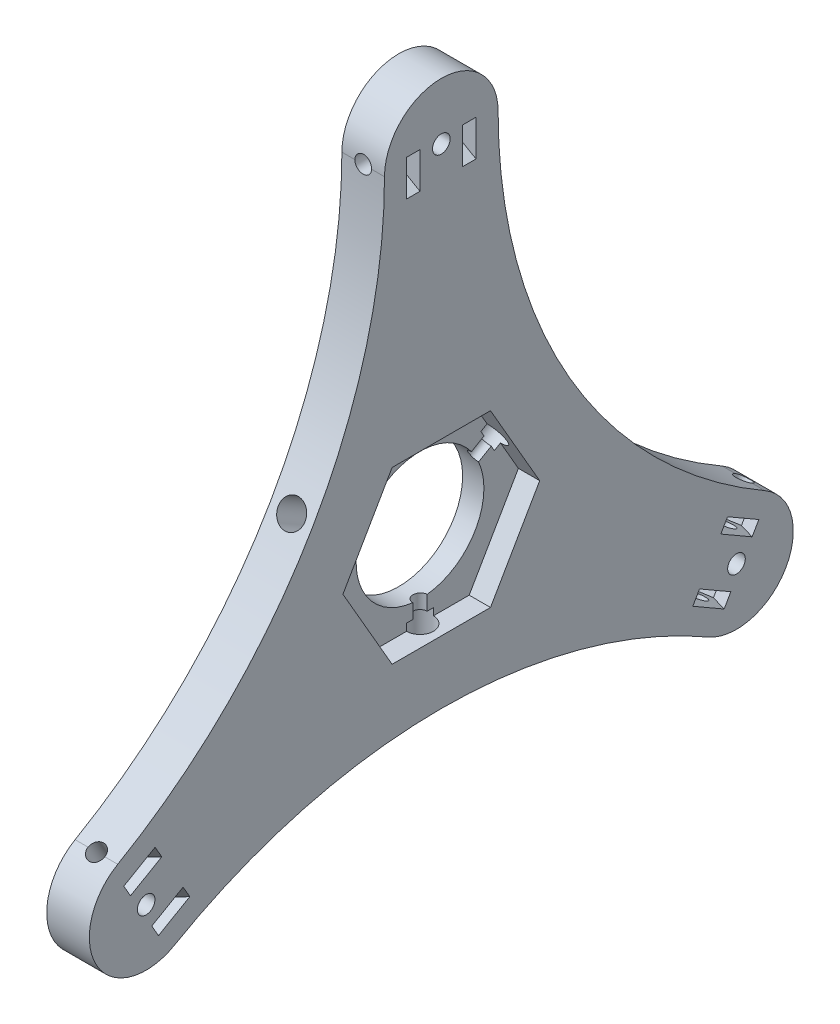
from build123d import *

# Parameters (mm, degrees)
SKETCH1_R                   = 1.9685
BOSS_EXTRUDE1_DEPTH         = 9.525
SKETCH3_R                   = 1.6
CUT_EXTRUDE1_DEPTH          = 121.530179668
CUT_EXTRUDE3_START          = -11.1125
SKETCH5_R                   = 2.999994
CUT_EXTRUDE3_DEPTH          = 110.417679676
CIRPATTERN9_COUNT           = 3
CUT_EXTRUDE2_START          = -3.175
CUT_EXTRUDE2_DEPTH          = 3.2
SKETCH6_R                   = 1.875
CUT_EXTRUDE4_DEPTH          = 120.105963224
CUT_EXTRUDE5_START          = -4.7625
CUT_EXTRUDE5_DEPTH          = 3
CIRPATTERN1_COUNT           = 3
CIRPATTERN1_COPY_1_SKETCH_R = 1.875
CIRPATTERN1_COPY_1_DEPTH    = 120.105963224
CIRPATTERN1_COPY_2_SKETCH_R = 1.875
CIRPATTERN1_COPY_2_DEPTH    = 120.105963224
CIRPATTERN1_START           = -4.7625
CIRPATTERN1_COPY_3_DEPTH    = 3
CIRPATTERN1_COPY_4_DEPTH    = 3
CIRPATTERN1_COPY_5_SKETCH_R = 1.875
CIRPATTERN1_COPY_5_DEPTH    = 120.105963224
CIRPATTERN1_COPY_6_SKETCH_R = 1.875
CIRPATTERN1_COPY_6_DEPTH    = 120.105963224
SKETCH8_R                   = 14.2875
CUT_EXTRUDE6_DEPTH          = 120.105963364
CUT_EXTRUDE7_DEPTH          = 4.7625


with BuildPart() as part:
    # Sketch1 → Boss-Extrude1 (new body)
    with BuildSketch(Plane(origin=(0, 0, 0), x_dir=(0, 0, -1), z_dir=(1, 0, 0))):
        with BuildLine():
            ThreePointArc((72.341135768, -27.101477372), (28.680794165, 16.558864232), (12.7, 76.2))
            ThreePointArc((12.7, 76.2), (0, 88.9), (-12.7, 76.2))
            ThreePointArc((-12.7, 76.2), (-28.680794165, 16.558864232), (-72.341135768, -27.101477372))
            ThreePointArc((-72.341135768, -27.101477372), (-76.989658396, -44.45), (-59.641135768, -49.098522628))
            ThreePointArc((-59.641135768, -49.098522628), (0, -33.117728463), (59.641135768, -49.098522628))
            ThreePointArc((59.641135768, -49.098522628), (76.989658396, -44.45), (72.341135768, -27.101477372))
        make_face()
        with Locations((-65.991135768, -38.1)):
            Circle(SKETCH1_R, mode=Mode.SUBTRACT)
        Polygon((-7.332348419, 0), (-3.666174209, 6.35), (3.666174209, 6.35), (7.332348419, 0), (3.666174209, -6.35), (-3.666174209, -6.35), align=None, mode=Mode.SUBTRACT)
        with Locations((65.991135768, -38.1)):
            Circle(SKETCH1_R, mode=Mode.SUBTRACT)
        with Locations((0, 76.2)):
            Circle(SKETCH1_R, mode=Mode.SUBTRACT)
    extrude(amount=BOSS_EXTRUDE1_DEPTH)

    # Sketch3 → Cut-Extrude1 (cut, through all)
    with BuildSketch(Plane(origin=(0, 3.175, 5.499261314), x_dir=(-1, 0, 0), z_dir=(0, -0.4999999999999999, -0.8660254037844387))):
        with Locations((-4.7625, 0)):
            Circle(SKETCH3_R)
    cut_extrude1 = extrude(amount=-CUT_EXTRUDE1_DEPTH, mode=Mode.SUBTRACT)

    # Sketch5 → Cut-Extrude3 (cut, through all)
    with BuildSketch(Plane(origin=(0, 3.175, 5.499261314), x_dir=(-1, 0, 0), z_dir=(0, -0.4999999999999999, -0.8660254037844387)).offset(CUT_EXTRUDE3_START)):
        with Locations((-4.7625, 0)):
            Circle(SKETCH5_R)
    cut_extrude3 = extrude(amount=-CUT_EXTRUDE3_DEPTH, mode=Mode.SUBTRACT)

    # CirPattern9: Cut-Extrude1, Cut-Extrude3 ×3 about axis
    cirpattern9_axis = Axis((-0.47625, 0, 0), (1, 0, 0))
    add([cut_extrude1.rotate(cirpattern9_axis, i * 360 / CIRPATTERN9_COUNT) for i in range(1, CIRPATTERN9_COUNT)], mode=Mode.SUBTRACT)
    add([cut_extrude3.rotate(cirpattern9_axis, i * 360 / CIRPATTERN9_COUNT) for i in range(1, CIRPATTERN9_COUNT)], mode=Mode.SUBTRACT)

    # Sketch4 → Cut-Extrude2 (cut)
    with BuildSketch(Plane(origin=(0, 3.175, 5.499261314), x_dir=(-1, 0, 0), z_dir=(0, -0.4999999999999999, -0.8660254037844387)).offset(CUT_EXTRUDE2_START)):
        Polygon((-3.174786782, 2.749999961), (-6.350213218, 2.749999961), (-9.525, 2.749999961), (-9.525, -2.749999961), (-6.350213218, -2.749999961), (-3.174786782, -2.749999961), (-1.587073564, 0), align=None)
    extrude(amount=-CUT_EXTRUDE2_DEPTH, mode=Mode.SUBTRACT)

    # Sketch6 → Cut-Extrude4 (cut, through all)
    with BuildSketch(Plane.XY):
        with Locations((4.7625, 76.2)):
            Circle(SKETCH6_R)
    cut_extrude4 = extrude(amount=-CUT_EXTRUDE4_DEPTH, mode=Mode.SUBTRACT)

    # Sketch7 → Cut-Extrude5 (cut)
    with BuildSketch(Plane.XY.offset(CUT_EXTRUDE5_START)):
        Polygon((8.2625, 78.220725942), (9.525, 77.491821227), (9.525, 69.408917459), (4.7625, 72.158548116), (1.2625, 74.179274058), (1.2625, 78.220725942), (4.7625, 80.241451884), align=None)
    cut_extrude5 = extrude(amount=-CUT_EXTRUDE5_DEPTH, mode=Mode.SUBTRACT)

    # Mirror1: Cut-Extrude4, Cut-Extrude5 across plane
    add(cut_extrude4.mirror(Plane.XY), mode=Mode.SUBTRACT)
    add(cut_extrude5.mirror(Plane.XY), mode=Mode.SUBTRACT)

    # CirPattern1: Cut-Extrude5 ×3 about axis
    cirpattern1_axis = Axis((-0.47625, 0, 0), (1, 0, 0))
    for i in range(1, CIRPATTERN1_COUNT):
        add(cut_extrude5.rotate(cirpattern1_axis, i * 360 / CIRPATTERN1_COUNT), mode=Mode.SUBTRACT)

    # CirPattern1 copy 1 sketch → CirPattern1 copy 1 (cut, through all)
    with BuildSketch(Plane(origin=(0, 0, 0), x_dir=(1, 0, 0), z_dir=(0, 0.8660254037844387, 0.4999999999999998))):
        with Locations((4.7625, -76.2)):
            Circle(CIRPATTERN1_COPY_1_SKETCH_R)
    extrude(amount=-CIRPATTERN1_COPY_1_DEPTH, mode=Mode.SUBTRACT)

    # CirPattern1 copy 2 sketch → CirPattern1 copy 2 (cut, through all)
    with BuildSketch(Plane(origin=(0, 0, 0), x_dir=(1, 0, 0), z_dir=(0, -0.8660254037844384, 0.5000000000000004))):
        with Locations((4.7625, -76.2)):
            Circle(CIRPATTERN1_COPY_2_SKETCH_R)
    extrude(amount=-CIRPATTERN1_COPY_2_DEPTH, mode=Mode.SUBTRACT)

    # CirPattern1 copy 3 sketch → CirPattern1 copy 3 (cut)
    with BuildSketch(Plane(origin=(0, 0, 0), x_dir=(1, 0, 0), z_dir=(0, 0.8660254037844387, 0.4999999999999998)).offset(CIRPATTERN1_START)):
        Polygon((8.2625, -78.220725942), (9.525, -77.491821227), (9.525, -69.408917459), (4.7625, -72.158548116), (1.2625, -74.179274058), (1.2625, -78.220725942), (4.7625, -80.241451884), align=None)
    extrude(amount=-CIRPATTERN1_COPY_3_DEPTH, mode=Mode.SUBTRACT)

    # CirPattern1 copy 4 sketch → CirPattern1 copy 4 (cut)
    with BuildSketch(Plane(origin=(0, 0, 0), x_dir=(1, 0, 0), z_dir=(0, -0.8660254037844384, 0.5000000000000004)).offset(CIRPATTERN1_START)):
        Polygon((8.2625, -78.220725942), (9.525, -77.491821227), (9.525, -69.408917459), (4.7625, -72.158548116), (1.2625, -74.179274058), (1.2625, -78.220725942), (4.7625, -80.241451884), align=None)
    extrude(amount=-CIRPATTERN1_COPY_4_DEPTH, mode=Mode.SUBTRACT)

    # CirPattern1 copy 5 sketch → CirPattern1 copy 5 (cut, through all)
    with BuildSketch(Plane(origin=(0, 0, 0), x_dir=(1, 0, 0), z_dir=(0, -0.8660254037844387, -0.4999999999999998))):
        with Locations((4.7625, 76.2)):
            Circle(CIRPATTERN1_COPY_5_SKETCH_R)
    extrude(amount=-CIRPATTERN1_COPY_5_DEPTH, mode=Mode.SUBTRACT)

    # CirPattern1 copy 6 sketch → CirPattern1 copy 6 (cut, through all)
    with BuildSketch(Plane(origin=(0, 0, 0), x_dir=(1, 0, 0), z_dir=(0, 0.8660254037844384, -0.5000000000000004))):
        with Locations((4.7625, 76.2)):
            Circle(CIRPATTERN1_COPY_6_SKETCH_R)
    extrude(amount=-CIRPATTERN1_COPY_6_DEPTH, mode=Mode.SUBTRACT)

    # Sketch8 → Cut-Extrude6 (cut, through all)
    with BuildSketch(Plane(origin=(9.525, 0, 0), x_dir=(0, 0, -1), z_dir=(1, 0, 0))):
        Circle(SKETCH8_R)
    extrude(amount=-CUT_EXTRUDE6_DEPTH, mode=Mode.SUBTRACT)

    # Sketch9 → Cut-Extrude7 (cut)
    with BuildSketch(Plane(origin=(9.525, 0, 0), x_dir=(0, 0, -1), z_dir=(1, 0, 0))):
        Polygon((-10.998522628, 19.05), (-21.997045256, 0), (-10.998522628, -19.05), (10.998522628, -19.05), (21.997045256, 0), (10.998522628, 19.05), align=None)
    extrude(amount=-CUT_EXTRUDE7_DEPTH, mode=Mode.SUBTRACT)


solid = part.part
